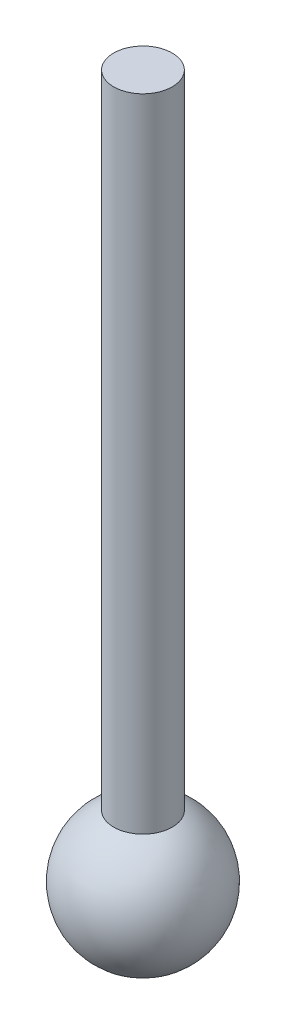
from build123d import *

# Parameters (mm, degrees)
REVOLVE1_ANGLE = 359.999695921


with BuildPart() as part:
    # Sketch1 → Revolve1 (revolve)
    with BuildSketch(Plane.XY):
        with BuildLine():
            Line((3, 6.32455532), (3, 72))
            Line((3, 72), (0, 72))
            Line((0, 72), (0, -7))
            ThreePointArc((0, -7), (6.829051444, -1.537548822), (3, 6.32455532))
        make_face()
    revolve(axis=Axis((0, -7, 0), (0, 1, 0)), revolution_arc=REVOLVE1_ANGLE)


solid = part.part
